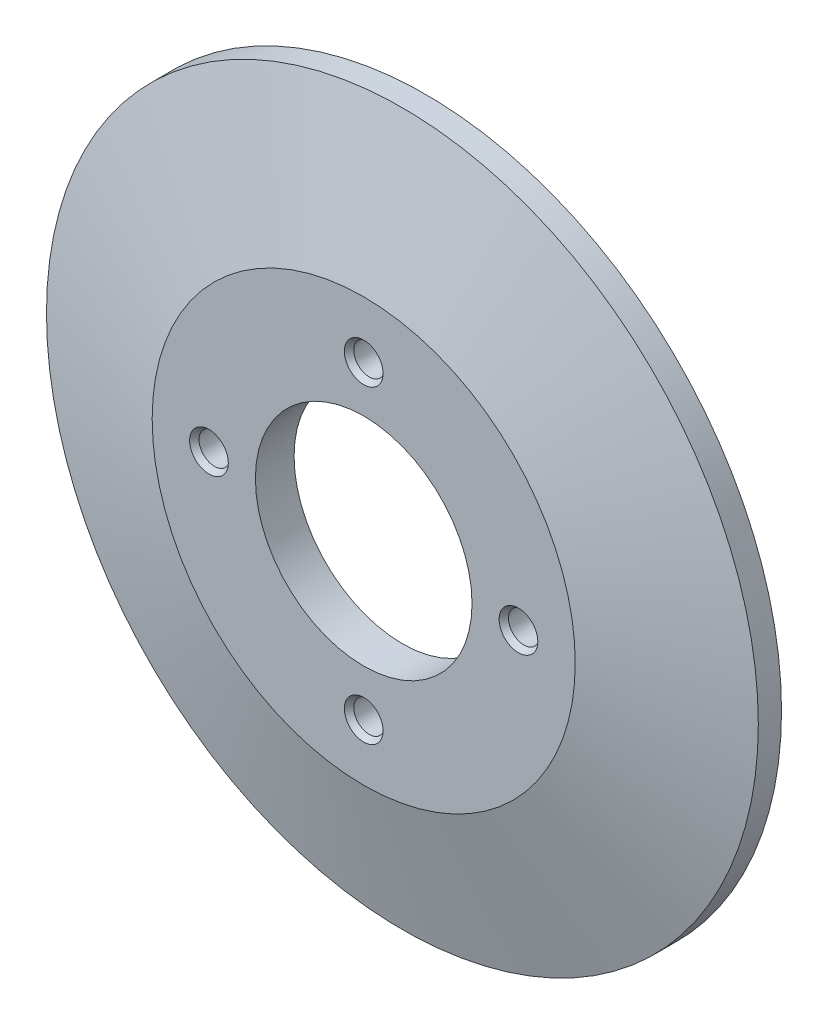
from build123d import *

# Parameters (mm, degrees)
ESQUISSE1_R             = 46
BOSS_EXTRU_1_DEPTH      = 3
ESQUISSE2_R             = 46
BOSS_EXTRU_2_DEPTH      = 5
BOSS_EXTRU_2_TAPER      = 75
ESQUISSE3_R             = 2
ENL_V_MAT_EXTRU_1_DEPTH = 66.543878433
ESQUISSE4_R             = 14
ENL_V_MAT_EXTRU_2_DEPTH = 66.543878433
CHANFREIN1_SIZE         = 0.5
CHANFREIN1_SIZE2        = 0.714074003


# Read off the part's stored shape, not the designer's step: Coque1
with BuildPart() as part:
    # Esquisse1 → Boss.-Extru.1 (new body)
    with BuildSketch(Plane.XY):
        Circle(ESQUISSE1_R)
    extrude(amount=BOSS_EXTRU_1_DEPTH)

    # Esquisse2 → Boss.-Extru.2 (add)
    with BuildSketch(Plane.XY.offset(3)):
        Circle(ESQUISSE2_R)
    extrude(amount=BOSS_EXTRU_2_DEPTH, taper=BOSS_EXTRU_2_TAPER)

    # Coque1 outline → Coque1 (revolve, cut)
    with BuildSketch(Plane.XZ):
        Polygon((37.877635897, 0), (26.681483474, 3), (0, 3), (0, 0), align=None)
    revolve(axis=Axis((0, 0, 0), (0, 0, 1)), mode=Mode.SUBTRACT)

    # Esquisse3 → Enlèv. mat.-Extru.1 (cut, through all)
    with BuildSketch(Plane.XY.offset(8)):
        with Locations((0, 20)):
            Circle(ESQUISSE3_R)
        with Locations((20, 0)):
            Circle(ESQUISSE3_R)
        with Locations((0, -20)):
            Circle(ESQUISSE3_R)
        with Locations((-20, 0)):
            Circle(ESQUISSE3_R)
    extrude(amount=-ENL_V_MAT_EXTRU_1_DEPTH, mode=Mode.SUBTRACT)

    # Esquisse4 → Enlèv. mat.-Extru.2 (cut, through all)
    with BuildSketch(Plane.XY.offset(8)):
        Circle(ESQUISSE4_R)
    extrude(amount=-ENL_V_MAT_EXTRU_2_DEPTH, mode=Mode.SUBTRACT)

    # Chanfrein1
    chanfrein1_edges = [part.edges().sort_by_distance(p)[0] for p in [
        (-2, 20, 8),
        (18, 0, 8),
        (-2, -20, 8),
        (-22, 0, 8),
    ]]
    chanfrein1_side = [part.faces().sort_by_distance(p)[0] for p in [
        (-26.566461172, 0, 8),
    ]]
    chamfer(chanfrein1_edges, length=CHANFREIN1_SIZE, length2=CHANFREIN1_SIZE2, reference=chanfrein1_side[0])


solid = part.part
